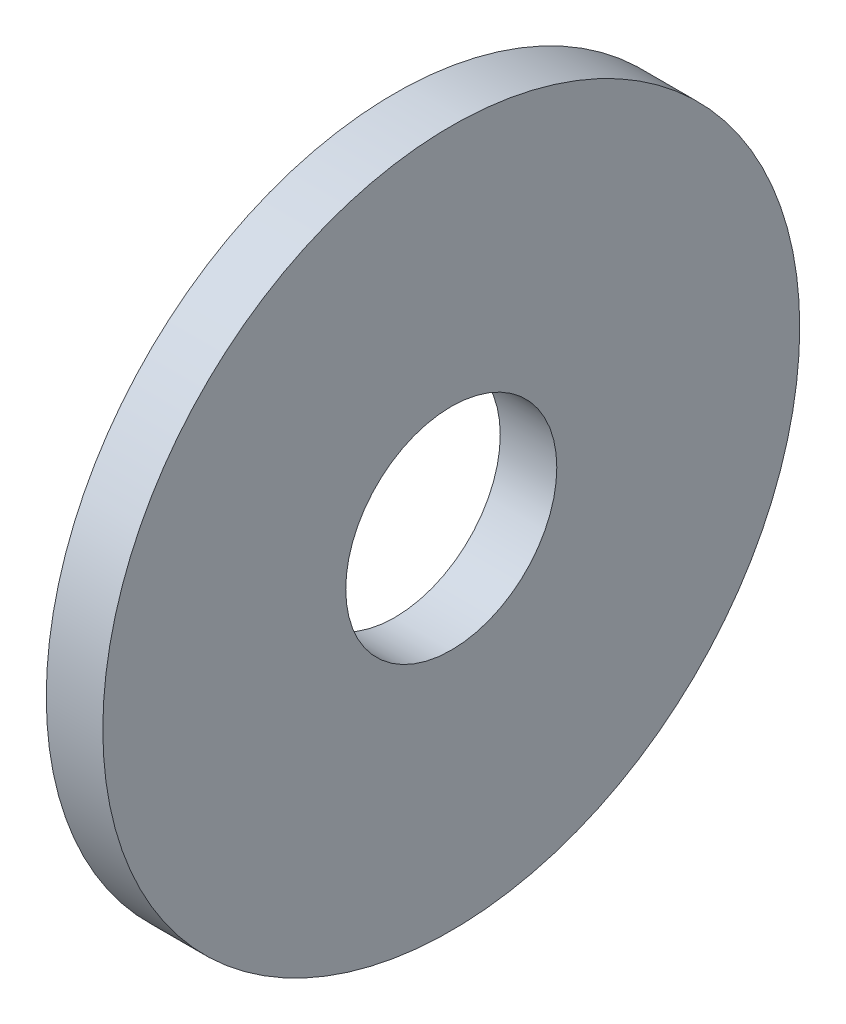
from build123d import *

# Parameters (mm, degrees)
SKETCH1_R           = 11.1125
SKETCH1_R_2         = 3.3655
BOSS_EXTRUDE1_DEPTH = 1.8034


with BuildPart() as part:
    # Sketch1 → Boss-Extrude1 (new body)
    with BuildSketch(Plane(origin=(0, 0, 0), x_dir=(0, 0, -1), z_dir=(1, 0, 0))):
        Circle(SKETCH1_R)
        Circle(SKETCH1_R_2, mode=Mode.SUBTRACT)
    extrude(amount=BOSS_EXTRUDE1_DEPTH)


solid = part.part
